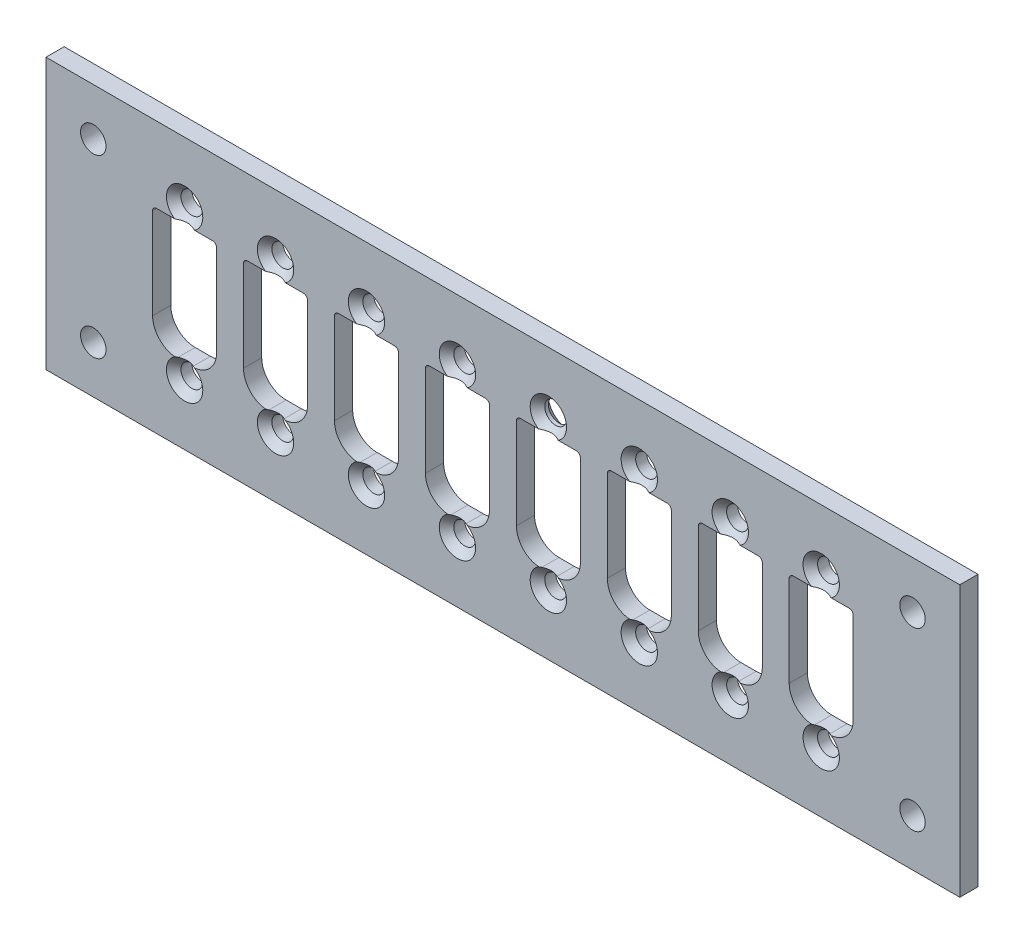
from build123d import *

# Parameters (mm, degrees)
SKETCH1_W           = 125.6
SKETCH1_H           = 37.2
SKETCH1_R           = 1.5
BOSS_EXTRUDE1_DEPTH = 2.5
CHAMFER2_SIZE       = 1
SKETCH2_R           = 1.75
CUT_EXTRUDE1_DEPTH  = 157.871666321


with BuildPart() as part:
    # Sketch1 → Boss-Extrude1 (new body)
    with BuildSketch(Plane(origin=(0, 0, 11.115132448), x_dir=(-1, 0, 0), z_dir=(0, 0, -1))):
        with Locations((-88.706029746, 22.000402025)):
            Rectangle(SKETCH1_W, SKETCH1_H)
        with Locations((-57.456029746, 11.700402025)):
            Circle(SKETCH1_R, mode=Mode.SUBTRACT)
        with Locations((-44.956029746, 11.700402025)):
            Circle(SKETCH1_R, mode=Mode.SUBTRACT)
        with Locations((-44.956029746, 32.300402025)):
            Circle(SKETCH1_R, mode=Mode.SUBTRACT)
        with Locations((-132.456029746, 32.300402025)):
            Circle(SKETCH1_R, mode=Mode.SUBTRACT)
        with Locations((-132.456029746, 11.700402025)):
            Circle(SKETCH1_R, mode=Mode.SUBTRACT)
        with Locations((-119.956029746, 11.700402025)):
            Circle(SKETCH1_R, mode=Mode.SUBTRACT)
        with Locations((-119.956029746, 32.300402025)):
            Circle(SKETCH1_R, mode=Mode.SUBTRACT)
        with Locations((-107.456029746, 32.300402025)):
            Circle(SKETCH1_R, mode=Mode.SUBTRACT)
        with Locations((-107.456029746, 11.700402025)):
            Circle(SKETCH1_R, mode=Mode.SUBTRACT)
        with Locations((-94.956029746, 11.700402025)):
            Circle(SKETCH1_R, mode=Mode.SUBTRACT)
        with Locations((-94.956029746, 32.300402025)):
            Circle(SKETCH1_R, mode=Mode.SUBTRACT)
        with Locations((-82.456029746, 32.300402025)):
            Circle(SKETCH1_R, mode=Mode.SUBTRACT)
        with Locations((-82.456029746, 11.700402025)):
            Circle(SKETCH1_R, mode=Mode.SUBTRACT)
        with Locations((-69.956029746, 11.700402025)):
            Circle(SKETCH1_R, mode=Mode.SUBTRACT)
        with Locations((-69.956029746, 32.300402025)):
            Circle(SKETCH1_R, mode=Mode.SUBTRACT)
        with Locations((-57.456029746, 32.300402025)):
            Circle(SKETCH1_R, mode=Mode.SUBTRACT)
        with BuildLine():
            Line((-61.856029746, 29.650402025), (-61.856029746, 17.150402025))
            ThreePointArc((-61.856029746, 17.150402025), (-60.874837463, 14.781594308), (-58.506029746, 13.800402025))
            Line((-58.506029746, 13.800402025), (-56.406029746, 13.800402025))
            ThreePointArc((-56.406029746, 13.800402025), (-54.037222029, 14.781594308), (-53.056029746, 17.150402025))
            Line((-53.056029746, 17.150402025), (-53.056029746, 29.650402025))
            ThreePointArc((-53.056029746, 29.650402025), (-53.217121016, 30.039310755), (-53.606029746, 30.200402025))
            Line((-53.606029746, 30.200402025), (-61.306029746, 30.200402025))
            ThreePointArc((-61.306029746, 30.200402025), (-61.694938475, 30.039310755), (-61.856029746, 29.650402025))
        make_face(mode=Mode.SUBTRACT)
        with BuildLine():
            Line((-49.356029746, 29.650402025), (-49.356029746, 17.150402025))
            ThreePointArc((-49.356029746, 17.150402025), (-48.374837463, 14.781594308), (-46.006029746, 13.800402025))
            Line((-46.006029746, 13.800402025), (-43.906029746, 13.800402025))
            ThreePointArc((-43.906029746, 13.800402025), (-41.537222029, 14.781594308), (-40.556029746, 17.150402025))
            Line((-40.556029746, 17.150402025), (-40.556029746, 29.650402025))
            ThreePointArc((-40.556029746, 29.650402025), (-40.717121016, 30.039310755), (-41.106029746, 30.200402025))
            Line((-41.106029746, 30.200402025), (-48.806029746, 30.200402025))
            ThreePointArc((-48.806029746, 30.200402025), (-49.194938475, 30.039310755), (-49.356029746, 29.650402025))
        make_face(mode=Mode.SUBTRACT)
        with BuildLine():
            Line((-74.356029746, 29.650402025), (-74.356029746, 17.150402025))
            ThreePointArc((-74.356029746, 17.150402025), (-73.374837463, 14.781594308), (-71.006029746, 13.800402025))
            Line((-71.006029746, 13.800402025), (-68.906029746, 13.800402025))
            ThreePointArc((-68.906029746, 13.800402025), (-66.537222029, 14.781594308), (-65.556029746, 17.150402025))
            Line((-65.556029746, 17.150402025), (-65.556029746, 29.650402025))
            ThreePointArc((-65.556029746, 29.650402025), (-65.717121016, 30.039310755), (-66.106029746, 30.200402025))
            Line((-66.106029746, 30.200402025), (-73.806029746, 30.200402025))
            ThreePointArc((-73.806029746, 30.200402025), (-74.194938475, 30.039310755), (-74.356029746, 29.650402025))
        make_face(mode=Mode.SUBTRACT)
        with BuildLine():
            Line((-86.856029746, 29.650402025), (-86.856029746, 17.150402025))
            ThreePointArc((-86.856029746, 17.150402025), (-85.874837463, 14.781594308), (-83.506029746, 13.800402025))
            Line((-83.506029746, 13.800402025), (-81.406029746, 13.800402025))
            ThreePointArc((-81.406029746, 13.800402025), (-79.037222029, 14.781594308), (-78.056029746, 17.150402025))
            Line((-78.056029746, 17.150402025), (-78.056029746, 29.650402025))
            ThreePointArc((-78.056029746, 29.650402025), (-78.217121016, 30.039310755), (-78.606029746, 30.200402025))
            Line((-78.606029746, 30.200402025), (-86.306029746, 30.200402025))
            ThreePointArc((-86.306029746, 30.200402025), (-86.694938475, 30.039310755), (-86.856029746, 29.650402025))
        make_face(mode=Mode.SUBTRACT)
        with BuildLine():
            Line((-99.356029746, 29.650402025), (-99.356029746, 17.150402025))
            ThreePointArc((-99.356029746, 17.150402025), (-98.374837463, 14.781594308), (-96.006029746, 13.800402025))
            Line((-96.006029746, 13.800402025), (-93.906029746, 13.800402025))
            ThreePointArc((-93.906029746, 13.800402025), (-91.537222029, 14.781594308), (-90.556029746, 17.150402025))
            Line((-90.556029746, 17.150402025), (-90.556029746, 29.650402025))
            ThreePointArc((-90.556029746, 29.650402025), (-90.717121016, 30.039310755), (-91.106029746, 30.200402025))
            Line((-91.106029746, 30.200402025), (-98.806029746, 30.200402025))
            ThreePointArc((-98.806029746, 30.200402025), (-99.194938475, 30.039310755), (-99.356029746, 29.650402025))
        make_face(mode=Mode.SUBTRACT)
        with BuildLine():
            Line((-111.856029746, 29.650402025), (-111.856029746, 17.150402025))
            ThreePointArc((-111.856029746, 17.150402025), (-110.874837463, 14.781594308), (-108.506029746, 13.800402025))
            Line((-108.506029746, 13.800402025), (-106.406029746, 13.800402025))
            ThreePointArc((-106.406029746, 13.800402025), (-104.037222029, 14.781594308), (-103.056029746, 17.150402025))
            Line((-103.056029746, 17.150402025), (-103.056029746, 29.650402025))
            ThreePointArc((-103.056029746, 29.650402025), (-103.217121016, 30.039310755), (-103.606029746, 30.200402025))
            Line((-103.606029746, 30.200402025), (-111.306029746, 30.200402025))
            ThreePointArc((-111.306029746, 30.200402025), (-111.694938475, 30.039310755), (-111.856029746, 29.650402025))
        make_face(mode=Mode.SUBTRACT)
        with BuildLine():
            Line((-124.356029746, 29.650402025), (-124.356029746, 17.150402025))
            ThreePointArc((-124.356029746, 17.150402025), (-123.374837463, 14.781594308), (-121.006029746, 13.800402025))
            Line((-121.006029746, 13.800402025), (-118.906029746, 13.800402025))
            ThreePointArc((-118.906029746, 13.800402025), (-116.537222029, 14.781594308), (-115.556029746, 17.150402025))
            Line((-115.556029746, 17.150402025), (-115.556029746, 29.650402025))
            ThreePointArc((-115.556029746, 29.650402025), (-115.717121016, 30.039310755), (-116.106029746, 30.200402025))
            Line((-116.106029746, 30.200402025), (-123.806029746, 30.200402025))
            ThreePointArc((-123.806029746, 30.200402025), (-124.194938475, 30.039310755), (-124.356029746, 29.650402025))
        make_face(mode=Mode.SUBTRACT)
        with BuildLine():
            Line((-136.856029746, 29.650402025), (-136.856029746, 17.150402025))
            ThreePointArc((-136.856029746, 17.150402025), (-135.874837463, 14.781594308), (-133.506029746, 13.800402025))
            Line((-133.506029746, 13.800402025), (-131.406029746, 13.800402025))
            ThreePointArc((-131.406029746, 13.800402025), (-129.037222029, 14.781594308), (-128.056029746, 17.150402025))
            Line((-128.056029746, 17.150402025), (-128.056029746, 29.650402025))
            ThreePointArc((-128.056029746, 29.650402025), (-128.217121016, 30.039310755), (-128.606029746, 30.200402025))
            Line((-128.606029746, 30.200402025), (-136.306029746, 30.200402025))
            ThreePointArc((-136.306029746, 30.200402025), (-136.694938475, 30.039310755), (-136.856029746, 29.650402025))
        make_face(mode=Mode.SUBTRACT)
    extrude(amount=-BOSS_EXTRUDE1_DEPTH)

    # Chamfer2
    # the kernel refuses this chamfer: 1 mm, written as the material it takes off along each edge
    with BuildSketch(Plane(origin=(94.956029746, 32.300402025, 11.115132448), x_dir=(-1, 0, 0), z_dir=(0, -1, 0))) as chamfer2_piece_1:
        Polygon((1.5, -CHAMFER2_SIZE), (1.5 + CHAMFER2_SIZE, 0), (1.5, 0), align=None)
    revolve(axis=Axis((94.956029746, 32.300402025, 11.115132448), (0, 0, -1)), mode=Mode.SUBTRACT)
    with BuildSketch(Plane(origin=(94.956029746, 32.300402025, 13.615132448), x_dir=(-1, 0, 0), z_dir=(0, -1, 0))) as chamfer2_piece_2:
        Polygon((1.5, CHAMFER2_SIZE), (1.5 + CHAMFER2_SIZE, 0), (1.5, 0), align=None)
    revolve(axis=Axis((94.956029746, 32.300402025, 13.615132448), (0, 0, -1)), mode=Mode.SUBTRACT)
    with BuildSketch(Plane(origin=(132.456029746, 32.300402025, 13.615132448), x_dir=(-1, 0, 0), z_dir=(0, -1, 0))) as chamfer2_piece_3:
        Polygon((1.5, CHAMFER2_SIZE), (1.5 + CHAMFER2_SIZE, 0), (1.5, 0), align=None)
    revolve(axis=Axis((132.456029746, 32.300402025, 13.615132448), (0, 0, -1)), mode=Mode.SUBTRACT)
    with BuildSketch(Plane(origin=(132.456029746, 11.700402025, 13.615132448), x_dir=(-1, 0, 0), z_dir=(0, -1, 0))) as chamfer2_piece_4:
        Polygon((1.5, CHAMFER2_SIZE), (1.5 + CHAMFER2_SIZE, 0), (1.5, 0), align=None)
    revolve(axis=Axis((132.456029746, 11.700402025, 13.615132448), (0, 0, -1)), mode=Mode.SUBTRACT)
    with BuildSketch(Plane(origin=(119.956029746, 11.700402025, 13.615132448), x_dir=(-1, 0, 0), z_dir=(0, -1, 0))) as chamfer2_piece_5:
        Polygon((1.5, CHAMFER2_SIZE), (1.5 + CHAMFER2_SIZE, 0), (1.5, 0), align=None)
    revolve(axis=Axis((119.956029746, 11.700402025, 13.615132448), (0, 0, -1)), mode=Mode.SUBTRACT)
    with BuildSketch(Plane(origin=(119.956029746, 32.300402025, 13.615132448), x_dir=(-1, 0, 0), z_dir=(0, -1, 0))) as chamfer2_piece_6:
        Polygon((1.5, CHAMFER2_SIZE), (1.5 + CHAMFER2_SIZE, 0), (1.5, 0), align=None)
    revolve(axis=Axis((119.956029746, 32.300402025, 13.615132448), (0, 0, -1)), mode=Mode.SUBTRACT)
    with BuildSketch(Plane(origin=(107.456029746, 32.300402025, 13.615132448), x_dir=(-1, 0, 0), z_dir=(0, -1, 0))) as chamfer2_piece_7:
        Polygon((1.5, CHAMFER2_SIZE), (1.5 + CHAMFER2_SIZE, 0), (1.5, 0), align=None)
    revolve(axis=Axis((107.456029746, 32.300402025, 13.615132448), (0, 0, -1)), mode=Mode.SUBTRACT)
    with BuildSketch(Plane(origin=(107.456029746, 11.700402025, 13.615132448), x_dir=(-1, 0, 0), z_dir=(0, -1, 0))) as chamfer2_piece_8:
        Polygon((1.5, CHAMFER2_SIZE), (1.5 + CHAMFER2_SIZE, 0), (1.5, 0), align=None)
    revolve(axis=Axis((107.456029746, 11.700402025, 13.615132448), (0, 0, -1)), mode=Mode.SUBTRACT)
    with BuildSketch(Plane(origin=(94.956029746, 11.700402025, 13.615132448), x_dir=(-1, 0, 0), z_dir=(0, -1, 0))) as chamfer2_piece_9:
        Polygon((1.5, CHAMFER2_SIZE), (1.5 + CHAMFER2_SIZE, 0), (1.5, 0), align=None)
    revolve(axis=Axis((94.956029746, 11.700402025, 13.615132448), (0, 0, -1)), mode=Mode.SUBTRACT)
    with BuildSketch(Plane(origin=(82.456029746, 32.300402025, 13.615132448), x_dir=(-1, 0, 0), z_dir=(0, -1, 0))) as chamfer2_piece_10:
        Polygon((1.5, CHAMFER2_SIZE), (1.5 + CHAMFER2_SIZE, 0), (1.5, 0), align=None)
    revolve(axis=Axis((82.456029746, 32.300402025, 13.615132448), (0, 0, -1)), mode=Mode.SUBTRACT)
    with BuildSketch(Plane(origin=(82.456029746, 11.700402025, 13.615132448), x_dir=(-1, 0, 0), z_dir=(0, -1, 0))) as chamfer2_piece_11:
        Polygon((1.5, CHAMFER2_SIZE), (1.5 + CHAMFER2_SIZE, 0), (1.5, 0), align=None)
    revolve(axis=Axis((82.456029746, 11.700402025, 13.615132448), (0, 0, -1)), mode=Mode.SUBTRACT)
    with BuildSketch(Plane(origin=(69.956029746, 11.700402025, 13.615132448), x_dir=(-1, 0, 0), z_dir=(0, -1, 0))) as chamfer2_piece_12:
        Polygon((1.5, CHAMFER2_SIZE), (1.5 + CHAMFER2_SIZE, 0), (1.5, 0), align=None)
    revolve(axis=Axis((69.956029746, 11.700402025, 13.615132448), (0, 0, -1)), mode=Mode.SUBTRACT)
    with BuildSketch(Plane(origin=(69.956029746, 32.300402025, 13.615132448), x_dir=(-1, 0, 0), z_dir=(0, -1, 0))) as chamfer2_piece_13:
        Polygon((1.5, CHAMFER2_SIZE), (1.5 + CHAMFER2_SIZE, 0), (1.5, 0), align=None)
    revolve(axis=Axis((69.956029746, 32.300402025, 13.615132448), (0, 0, -1)), mode=Mode.SUBTRACT)
    with BuildSketch(Plane(origin=(57.456029746, 32.300402025, 13.615132448), x_dir=(-1, 0, 0), z_dir=(0, -1, 0))) as chamfer2_piece_14:
        Polygon((1.5, CHAMFER2_SIZE), (1.5 + CHAMFER2_SIZE, 0), (1.5, 0), align=None)
    revolve(axis=Axis((57.456029746, 32.300402025, 13.615132448), (0, 0, -1)), mode=Mode.SUBTRACT)
    with BuildSketch(Plane(origin=(57.456029746, 11.700402025, 13.615132448), x_dir=(-1, 0, 0), z_dir=(0, -1, 0))) as chamfer2_piece_15:
        Polygon((1.5, CHAMFER2_SIZE), (1.5 + CHAMFER2_SIZE, 0), (1.5, 0), align=None)
    revolve(axis=Axis((57.456029746, 11.700402025, 13.615132448), (0, 0, -1)), mode=Mode.SUBTRACT)
    with BuildSketch(Plane(origin=(44.956029746, 11.700402025, 13.615132448), x_dir=(-1, 0, 0), z_dir=(0, -1, 0))) as chamfer2_piece_16:
        Polygon((1.5, CHAMFER2_SIZE), (1.5 + CHAMFER2_SIZE, 0), (1.5, 0), align=None)
    revolve(axis=Axis((44.956029746, 11.700402025, 13.615132448), (0, 0, -1)), mode=Mode.SUBTRACT)
    with BuildSketch(Plane(origin=(44.956029746, 32.300402025, 13.615132448), x_dir=(-1, 0, 0), z_dir=(0, -1, 0))) as chamfer2_piece_17:
        Polygon((1.5, CHAMFER2_SIZE), (1.5 + CHAMFER2_SIZE, 0), (1.5, 0), align=None)
    revolve(axis=Axis((44.956029746, 32.300402025, 13.615132448), (0, 0, -1)), mode=Mode.SUBTRACT)

    # Sketch2 → Cut-Extrude1 (cut, through all)
    with BuildSketch(Plane.XY.offset(13.615132448)):
        with Locations((145.006029746, 34.100402025)):
            Circle(SKETCH2_R)
        with Locations((145.006029746, 9.900402025)):
            Circle(SKETCH2_R)
        with Locations((32.406029746, 9.900402025)):
            Circle(SKETCH2_R)
        with Locations((32.406029746, 34.100402025)):
            Circle(SKETCH2_R)
    extrude(amount=-CUT_EXTRUDE1_DEPTH, mode=Mode.SUBTRACT)


solid = part.part
